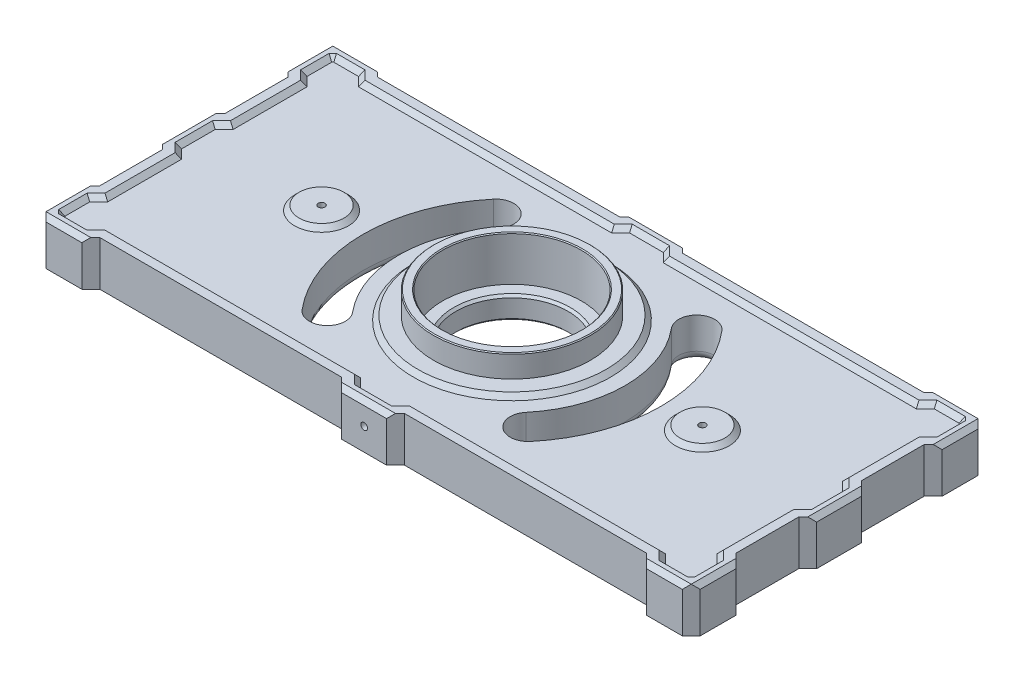
from build123d import *

# Parameters (mm, degrees)
BOSS_EXTRUDE1_DEPTH  = 10
MIRROR1_DEPTH        = 10
SKETCH2_R            = 17.5
SKETCH2_R_2          = 15.5
BOSS_EXTRUDE2_DEPTH  = 5
CUT_EXTRUDE2_START   = -5
SKETCH3_R            = 15.5
CUT_EXTRUDE2_DEPTH   = 5
SKETCH4_R            = 12.5
CUT_EXTRUDE3_DEPTH   = 81.734131568
CHAMFER2_SIZE        = 0.2
CHAMFER4_SIZE        = 0.5
SKETCH5_R            = 5
SKETCH5_R_2          = 21
CUT_EXTRUDE5_DEPTH   = 1
CHAMFER6_SIZE        = 1
SKETCH6_R            = 0.75
CUT_EXTRUDE6_DEPTH   = 7
SKETCH7_R            = 0.75
CUT_EXTRUDE7_DEPTH   = 7
CUT_EXTRUDE8_DEPTH   = 151.432709209
CUT_EXTRUDE9_DEPTH   = 100.548982918
CUT_EXTRUDE10_DEPTH  = 81.616375508
FILLET3_R            = 2
FILLET3_OF_MIRROR3_R = 2
SKETCH11_R           = 0.75
CUT_EXTRUDE11_DEPTH  = 5


# Read off the part's stored shape, not the designer's step: Mirror1
with BuildPart() as part:
    # Sketch1 → Boss-Extrude1 (new body)
    with BuildSketch(Plane(origin=(0, 0, 0), x_dir=(1, 0, 0), z_dir=(0, 1, 0))):
        Polygon((-73, 31), (-71, 33), (-63, 33), (-61, 31), (-7, 31), (-5, 33), (0, 33), (0, 0), (-73, 0), (-73, 5), (-71, 7), (-71, 21), (-73, 23), align=None)
    extrude(amount=BOSS_EXTRUDE1_DEPTH)

    # Mirror1 outline → Mirror1 (add)
    with BuildSketch(Plane(origin=(0, 0, 0), x_dir=(1, 0, 0), z_dir=(0, 1, 0))):
        Polygon((-73, 0), (-73, -5), (-71, -7), (-71, -21), (-73, -23), (-73, -31), (-71, -33), (-63, -33), (-61, -31), (-7, -31), (-5, -33), (5, -33), (7, -31), (61, -31), (63, -33), (71, -33), (73, -31), (73, -23), (71, -21), (71, -7), (73, -5), (73, 5), (71, 7), (71, 21), (73, 23), (73, 31), (71, 33), (63, 33), (61, 31), (7, 31), (5, 33), (0, 33), (0, 0), align=None)
    extrude(amount=MIRROR1_DEPTH)

    # Sketch2 → Boss-Extrude2 (add)
    with BuildSketch(Plane(origin=(0, 10, 0), x_dir=(1, 0, 0), z_dir=(0, 1, 0))):
        with Locations(Location((0, 0, 0), (0, 0, 90))):
            Circle(SKETCH2_R)
        with Locations(Location((0, 0, 0), (0, 0, 270))):
            Circle(SKETCH2_R_2, mode=Mode.SUBTRACT)
    extrude(amount=BOSS_EXTRUDE2_DEPTH)

    # Sketch3 → Cut-Extrude2 (cut)
    with BuildSketch(Plane(origin=(0, 10, 0), x_dir=(1, 0, 0), z_dir=(0, 1, 0)).offset(CUT_EXTRUDE2_START)):
        with Locations(Location((0, 0, 0), (0, 0, 270))):
            Circle(SKETCH3_R)
    extrude(amount=CUT_EXTRUDE2_DEPTH, mode=Mode.SUBTRACT)

    # Sketch4 → Cut-Extrude3 (cut, through all)
    with BuildSketch(Plane(origin=(0, 5, 0), x_dir=(1, 0, 0), z_dir=(0, 1, 0))):
        with Locations(Location((0, 0, 0), (0, 0, 270))):
            Circle(SKETCH4_R)
    extrude(amount=-CUT_EXTRUDE3_DEPTH, mode=Mode.SUBTRACT)

    # Chamfer2
    chamfer2_edges = [part.edges().sort_by_distance(p)[0] for p in [
        (0, 15, 17.5),
        (0, 15, -15.5),
    ]]
    chamfer(chamfer2_edges, length=CHAMFER2_SIZE)

    # Chamfer4
    chamfer4_edges = [part.edges().sort_by_distance(p)[0] for p in [
        (0, 0, -12.5),
        (0, 5, -12.5),
    ]]
    chamfer(chamfer4_edges, length=CHAMFER4_SIZE)

    # Sketch5 → Cut-Extrude5 (cut)
    with BuildSketch(Plane.XZ.offset(-10)):
        Polygon((71, 4.171572875), (69, 6.171572875), (69, 21.828427125), (71, 23.828427125), (71, 30.171572875), (70.171572875, 31), (63.828427125, 31), (61.828427125, 29), (6.171572875, 29), (4.171572875, 31), (-4.171572875, 31), (-6.171572875, 29), (-61.828427125, 29), (-63.828427125, 31), (-70.171572875, 31), (-71, 30.171572875), (-71, 23.828427125), (-69, 21.828427125), (-69, 6.171572875), (-71, 4.171572875), (-71, -4.171572875), (-69, -6.171572875), (-69, -21.828427125), (-71, -23.828427125), (-71, -30.171572875), (-70.171572875, -31), (-63.828427125, -31), (-61.828427125, -29), (-6.171572875, -29), (-4.171572875, -31), (4.171572875, -31), (6.171572875, -29), (61.828427125, -29), (63.828427125, -31), (70.171572875, -31), (71, -30.171572875), (71, -23.828427125), (69, -21.828427125), (69, -6.171572875), (71, -4.171572875), align=None)
        with Locations(Location((-42.5, 0, 0), (0, 0, 270))):
            Circle(SKETCH5_R, mode=Mode.SUBTRACT)
        with Locations(Location((42.5, 0, 0), (0, 0, 270))):
            Circle(SKETCH5_R, mode=Mode.SUBTRACT)
        with Locations(Location((0, 0, 0), (0, 0, 270))):
            Circle(SKETCH5_R_2, mode=Mode.SUBTRACT)
    extrude(amount=CUT_EXTRUDE5_DEPTH, mode=Mode.SUBTRACT)

    # Chamfer6
    chamfer6_edges = [part.edges().sort_by_distance(p)[0] for p in [
        (0, 9, 21),
        (67, 9, 31),
        (62.828427125, 9, 30),
        (34, 9, 29),
        (5.171572875, 9, 30),
        (0, 9, 31),
        (-5.171572875, 9, 30),
        (-34, 9, 29),
        (-62.828427125, 9, 30),
        (-67, 9, 31),
        (-71, 9, 27),
        (-70, 9, 22.828427125),
        (-69, 9, 14),
        (-70, 9, 5.171572875),
        (-71, 9, 0),
        (-70, 9, -5.171572875),
        (-69, 9, -14),
        (-70, 9, -22.828427125),
        (-71, 9, -27),
        (-67, 9, -31),
        (-62.828427125, 9, -30),
        (-34, 9, -29),
        (-5.171572875, 9, -30),
        (0, 9, -31),
        (5.171572875, 9, -30),
        (34, 9, -29),
        (62.828427125, 9, -30),
        (67, 9, -31),
        (71, 9, -27),
        (70, 9, -22.828427125),
        (69, 9, -14),
        (70, 9, -5.171572875),
        (71, 9, 0),
        (70, 9, 5.171572875),
        (69, 9, 14),
        (70, 9, 22.828427125),
        (71, 9, 27),
        (70.585786438, 9, 30.585786438),
        (-70.585786438, 9, 30.585786438),
        (-70.585786438, 9, -30.585786438),
        (70.585786438, 9, -30.585786438),
        (-42.5, 9, 5),
        (42.5, 9, 5),
    ]]
    chamfer(chamfer6_edges, length=CHAMFER6_SIZE - 0.0001)  # a hair under: the kernel refuses the full size

    # Sketch6 → Cut-Extrude6 (cut)
    with BuildSketch(Plane.XY.offset(33)):
        with Locations((0, 5)):
            Circle(SKETCH6_R)
    cut_extrude6 = extrude(amount=-CUT_EXTRUDE6_DEPTH, mode=Mode.SUBTRACT)

    # Mirror2: Cut-Extrude6 across plane
    add(cut_extrude6.mirror(Plane.XY), mode=Mode.SUBTRACT)

    # Sketch7 → Cut-Extrude7 (cut)
    with BuildSketch(Plane(origin=(0, 10, 0), x_dir=(1, 0, 0), z_dir=(0, 1, 0))):
        with Locations(Location((-42.5, 0, 0), (0, 0, 270))):
            Circle(SKETCH7_R)
        with Locations(Location((42.5, 0, 0), (0, 0, 270))):
            Circle(SKETCH7_R)
    extrude(amount=-CUT_EXTRUDE7_DEPTH, mode=Mode.SUBTRACT)

    # Sketch8 → Cut-Extrude8 (cut, through all)
    with BuildSketch(Plane.ZY.offset(73)):
        Polygon((-33, 9), (-32, 10), (-33, 10), align=None)
        Polygon((33, 10), (32, 10), (33, 9), align=None)
    extrude(amount=-CUT_EXTRUDE8_DEPTH, mode=Mode.SUBTRACT)

    # Sketch9 → Cut-Extrude9 (cut, through all)
    with BuildSketch(Plane.XY.offset(33)):
        Polygon((-73, 10), (-72, 10), (-73, 9), align=None)
        Polygon((72, 10), (73, 10), (73, 9), align=None)
    extrude(amount=-CUT_EXTRUDE9_DEPTH, mode=Mode.SUBTRACT)

    # Sketch10 → Cut-Extrude10 (cut, through all)
    with BuildSketch(Plane(origin=(0, 9, 0), x_dir=(1, 0, 0), z_dir=(0, 1, 0))):
        with BuildLine():
            ThreePointArc((-19.342622189, 16.230387145), (-19.835649522, 21.865715356), (-25.470977734, 21.372688022))
            ThreePointArc((-25.470977734, 21.372688022), (-33.25, 0), (-25.470977734, -21.372688022))
            ThreePointArc((-25.470977734, -21.372688022), (-19.835649522, -21.865715356), (-19.342622189, -16.230387145))
            ThreePointArc((-19.342622189, -16.230387145), (-25.25, 0), (-19.342622189, 16.230387145))
        make_face()
    cut_extrude10 = extrude(amount=-CUT_EXTRUDE10_DEPTH, mode=Mode.SUBTRACT)

    # Fillet3
    fillet3_edges = [part.edges().sort_by_distance(p)[0] for p in [
        (-33.25, 0, 0),
        (-19.835649522, 0, -21.865715356),
        (-25.25, 0, 0),
        (-19.835649522, 0, 21.865715356),
    ]]
    fillet(fillet3_edges, radius=FILLET3_R)

    # Mirror3: Cut-Extrude10 across plane
    add(cut_extrude10.mirror(Plane(origin=(0, 0, 0), x_dir=(0, 0, 1), z_dir=(1, 0, 0))), mode=Mode.SUBTRACT)

    # Fillet3 of Mirror3
    fillet3_of_mirror3_edges = [part.edges().sort_by_distance(p)[0] for p in [
        (33.25, 0, 0),
        (19.835649522, 0, -21.865715356),
        (25.25, 0, 0),
        (19.835649522, 0, 21.865715356),
    ]]
    fillet(fillet3_of_mirror3_edges, radius=FILLET3_OF_MIRROR3_R)

    # Sketch11 → Cut-Extrude11 (cut)
    with BuildSketch(Plane.XZ):
        with Locations(Location((0, 17.2, 0), (0, 0, 270))):
            Circle(SKETCH11_R)
        with Locations(Location((45.6, 10.2, 0), (0, 0, 270))):
            Circle(SKETCH11_R)
        with Locations(Location((45.6, -10.2, 0), (0, 0, 270))):
            Circle(SKETCH11_R)
        with Locations(Location((0, -17.2, 0), (0, 0, 270))):
            Circle(SKETCH11_R)
    extrude(amount=-CUT_EXTRUDE11_DEPTH, mode=Mode.SUBTRACT)


solid = part.part
